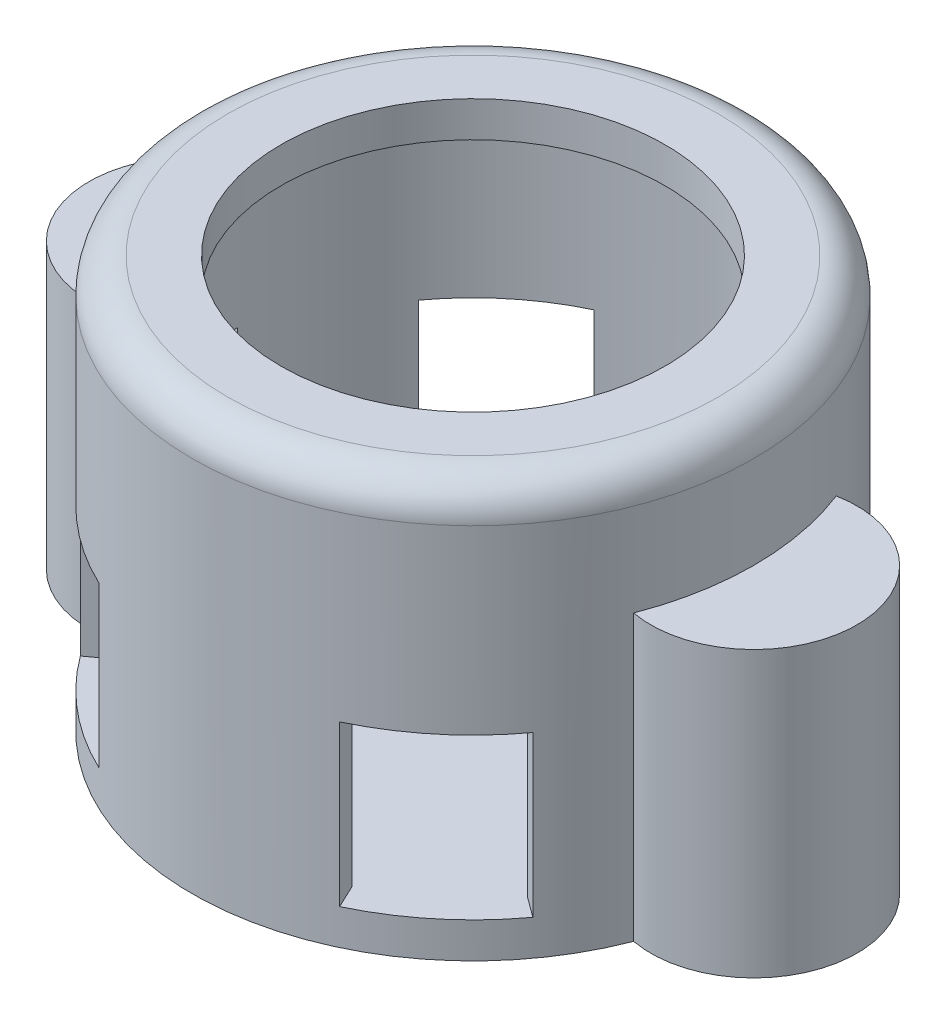
from build123d import *

# Parameters (mm, degrees)
BOSS_EXTRUDE1_DEPTH      = 11.6
BOSS_EXTRUDE2_DEPTH      = 8
SKETCH2_R                = 7.167468034
BOSS_EXTRUDE3_DEPTH      = 1
BOSS_EXTRUDE4_START      = -1
SKETCH3_R                = 7.167468034
SKETCH3_R_2              = 5.4
BOSS_EXTRUDE4_DEPTH      = 1
FILLET1_R                = 1
WRAP1_SECTION_W          = 3
WRAP1_SECTION_H          = 4.5
WRAP1_ANGLE              = 28.285258241
WRAP1_SECTOR_2_SECTION_W = 3
WRAP1_SECTOR_2_SECTION_H = 4.5
WRAP1_SECTOR_2_ANGLE     = 28.285258241
WRAP2_START              = 1
WRAP2_DEPTH              = 4.5
SKETCH6_R                = 1
CUT_EXTRUDE1_DEPTH       = 6


# Read off the part's stored shape, not the designer's step: Wrap2
with BuildPart() as part:
    # Sketch1 → Boss-Extrude1 (new body)
    with BuildSketch(Plane(origin=(0, 0, 0), x_dir=(1, 0, 0), z_dir=(0, 1, 0))):
        with BuildLine():
            ThreePointArc((-7.167468034, 0), (0, 7.167468034), (7.167468034, 0))
            Line((7.167468034, 0), (7.9, 0))
            ThreePointArc((7.9, 0), (7.765790365, 1.45), (7.367721519, 2.850733172))
            ThreePointArc((7.367721519, 2.850733172), (0, 7.9), (-7.367721519, 2.850733172))
            ThreePointArc((-7.367721519, 2.850733172), (-7.765790365, 1.45), (-7.9, 0))
            Line((-7.9, 0), (-7.167468034, 0))
        make_face()
        with BuildLine():
            Line((7.9, 0), (7.167468034, 0))
            ThreePointArc((7.167468034, 0), (0, -7.167468034), (-7.167468034, 0))
            Line((-7.167468034, 0), (-7.9, 0))
            ThreePointArc((-7.9, 0), (-7.765790365, -1.45), (-7.367721519, -2.850733172))
            ThreePointArc((-7.367721519, -2.850733172), (0, -7.9), (7.367721519, -2.850733172))
            ThreePointArc((7.367721519, -2.850733172), (7.765790365, -1.45), (7.9, 0))
        make_face()
    extrude(amount=BOSS_EXTRUDE1_DEPTH)

    # Sketch1<3> → Boss-Extrude2 (add)
    with BuildSketch(Plane(origin=(0, 0, 0), x_dir=(1, 0, 0), z_dir=(0, 1, 0))):
        with BuildLine():
            ThreePointArc((-7.367721519, -2.850733172), (-7.765790365, -1.45), (-7.9, 0))
            Line((-7.9, 0), (-10.8, 0))
            ThreePointArc((-10.8, 0), (-9.75288861, -2.230875119), (-7.367721519, -2.850733172))
        make_face()
        with BuildLine():
            Line((-10.8, 0), (-7.9, 0))
            ThreePointArc((-7.9, 0), (-7.765790365, 1.45), (-7.367721519, 2.850733172))
            ThreePointArc((-7.367721519, 2.850733172), (-9.75288861, 2.230875119), (-10.8, 0))
        make_face()
        with BuildLine():
            ThreePointArc((7.367721519, 2.850733172), (7.765790365, 1.45), (7.9, 0))
            Line((7.9, 0), (10.8, 0))
            ThreePointArc((10.8, 0), (9.75288861, 2.230875119), (7.367721519, 2.850733172))
        make_face()
        with BuildLine():
            Line((10.8, 0), (7.9, 0))
            ThreePointArc((7.9, 0), (7.765790365, -1.45), (7.367721519, -2.850733172))
            ThreePointArc((7.367721519, -2.850733172), (9.75288861, -2.230875119), (10.8, 0))
        make_face()
    extrude(amount=BOSS_EXTRUDE2_DEPTH)

    # Sketch2 → Boss-Extrude3 (add)
    with BuildSketch(Plane(origin=(0, 0, 0), x_dir=(1, 0, 0), z_dir=(0, 1, 0))):
        with Locations(Location((0, 0, 0), (0, 0, 270))):
            Circle(SKETCH2_R)
    extrude(amount=BOSS_EXTRUDE3_DEPTH)

    # Sketch3 → Boss-Extrude4 (add)
    with BuildSketch(Plane(origin=(0, 11.6, 0), x_dir=(1, 0, 0), z_dir=(0, 1, 0)).offset(BOSS_EXTRUDE4_START)):
        with Locations(Location((0, 0, 0), (0, 0, 270))):
            Circle(SKETCH3_R)
        with Locations(Location((0, 0, 0), (0, 0, 270))):
            Circle(SKETCH3_R_2, mode=Mode.SUBTRACT)
    extrude(amount=BOSS_EXTRUDE4_DEPTH)

    # Fillet1
    fillet1_edges = [part.edges().sort_by_distance(p)[0] for p in [
        (7.9, 11.6, 0),
    ]]
    fillet(fillet1_edges, radius=FILLET1_R)

    # Wrap1 section (on wrap section) → Wrap1 (revolve, cut)
    with BuildSketch(Plane(origin=(0, 0, 0), x_dir=(-0.8056126558283049, 0, -0.5924426122159557), z_dir=(-0.5924426122159557, 0, 0.8056126558283049))):
        with Locations((6.4, -3.25)):
            Rectangle(WRAP1_SECTION_W, WRAP1_SECTION_H)
    revolve(axis=Axis((0, 0, 0), (0, -1, 0)), revolution_arc=WRAP1_ANGLE, mode=Mode.SUBTRACT)

    # Wrap1 sector 2 section (on wrap section) → Wrap1 sector 2 (revolve, cut)
    with BuildSketch(Plane(origin=(0, 0, 0), x_dir=(0.4286861079278577, 0, -0.9034534967941986), z_dir=(-0.9034534967941986, 0, -0.4286861079278577))):
        with Locations((6.4, -3.25)):
            Rectangle(WRAP1_SECTOR_2_SECTION_W, WRAP1_SECTOR_2_SECTION_H)
    revolve(axis=Axis((0, 0, 0), (0, -1, 0)), revolution_arc=WRAP1_SECTOR_2_ANGLE, mode=Mode.SUBTRACT)

    # Wrap2 outline → Wrap2 (cut)
    with BuildSketch(Plane(origin=(0, 0, 0), x_dir=(1, 0, 0), z_dir=(0, 1, 0)).offset(WRAP2_START)):
        with BuildLine():
            ThreePointArc((5.774202958, -4.246313485), (4.561660138, -5.528458629), (3.072593975, -6.475474058))
            Line((3.072593975, -6.475474058), (3.386620253, -7.137282625))
            ThreePointArc((3.386620253, -7.137282625), (5.027872453, -6.093480007), (6.364339981, -4.680296637))
            Line((6.364339981, -4.680296637), (5.774202958, -4.246313485))
        make_face()
        with BuildLine():
            Line((-3.386620253, -7.137282625), (-3.072593975, -6.475474058))
            ThreePointArc((-3.072593975, -6.475474058), (-4.561660138, -5.528458629), (-5.774202958, -4.246313485))
            Line((-5.774202958, -4.246313485), (-6.364339981, -4.680296637))
            ThreePointArc((-6.364339981, -4.680296637), (-5.027872453, -6.093480007), (-3.386620253, -7.137282625))
        make_face()
    extrude(amount=WRAP2_DEPTH, mode=Mode.SUBTRACT)

    # Sketch6 → Cut-Extrude1 (cut)
    with BuildSketch(Plane.XZ):
        with Locations(Location((-8, 0, 0), (0, 0, 270))):
            Circle(SKETCH6_R)
        with Locations(Location((8, 0, 0), (0, 0, 270))):
            Circle(SKETCH6_R)
    extrude(amount=-CUT_EXTRUDE1_DEPTH, mode=Mode.SUBTRACT)


solid = part.part
